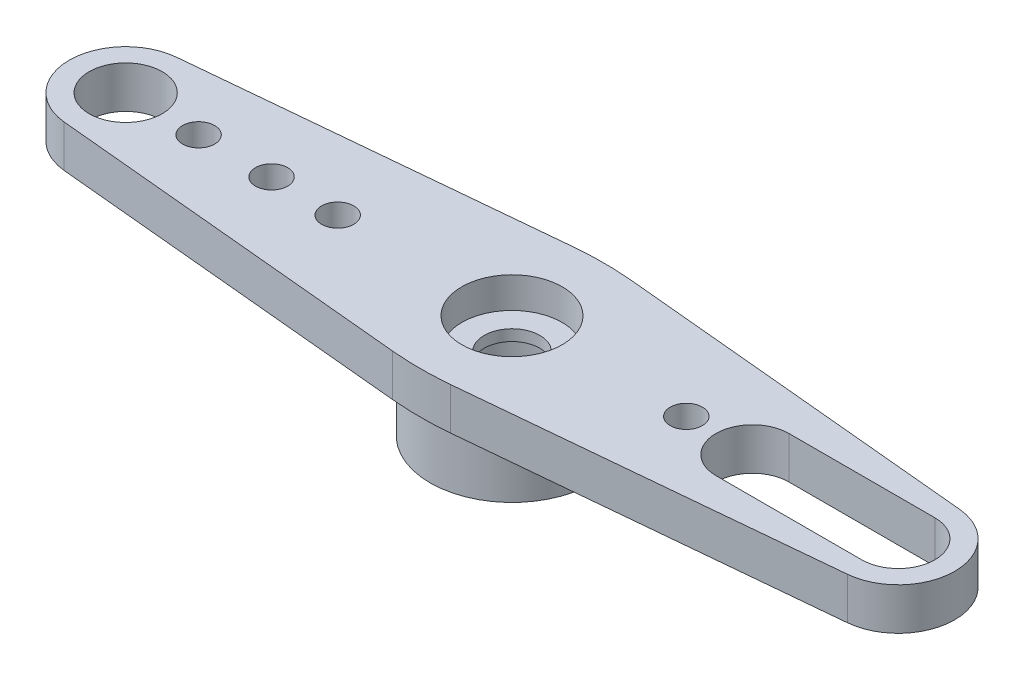
from build123d import *

# Parameters (mm, degrees)
SKETCH1_R           = 3.3655
SKETCH1_R_2         = 2.2352
BOSS_EXTRUDE1_DEPTH = 2.54
SKETCH2_R           = 0.6604
SKETCH2_R_2         = 1.5
SKETCH2_R_3         = 1.143
BOSS_EXTRUDE2_DEPTH = 1.7272
FILLET1_R           = 12.7
CUT_EXTRUDE1_START  = -1.27
SKETCH3_R           = 2.06375
SKETCH3_R_2         = 1.143
CUT_EXTRUDE1_DEPTH  = 1.27


with BuildPart() as part:
    # Sketch1 → Boss-Extrude1 (new body)
    with BuildSketch(Plane(origin=(0, 0, 0), x_dir=(1, 0, 0), z_dir=(0, 1, 0))):
        Circle(SKETCH1_R)
        Circle(SKETCH1_R_2, mode=Mode.SUBTRACT)
    extrude(amount=BOSS_EXTRUDE1_DEPTH)

    # Sketch2 → Boss-Extrude2 (add)
    with BuildSketch(Plane(origin=(0, 2.54, 0), x_dir=(1, 0, 0), z_dir=(0, 1, 0))):
        with BuildLine():
            Line((0, 3.8227), (-16.092265178, 2.307544345))
            ThreePointArc((-16.092265178, 2.307544345), (-18.19275, 0), (-16.092265178, -2.307544345))
            Line((-16.092265178, -2.307544345), (0, -3.8227))
            Line((0, -3.8227), (16.092265178, -2.307544345))
            ThreePointArc((16.092265178, -2.307544345), (18.19275, 0), (16.092265178, 2.307544345))
            Line((16.092265178, 2.307544345), (0, 3.8227))
        make_face()
        with BuildLine():
            Line((9.8806, 1.5), (15.875, 1.5))
            ThreePointArc((15.875, 1.5), (17.375, 0), (15.875, -1.5))
            Line((15.875, -1.5), (9.8806, -1.5))
            ThreePointArc((9.8806, -1.5), (8.3806, 0), (9.8806, 1.5))
        make_face(mode=Mode.SUBTRACT)
        with Locations((7.1628, 0)):
            Circle(SKETCH2_R, mode=Mode.SUBTRACT)
        with Locations((-7.1628, 0)):
            Circle(SKETCH2_R, mode=Mode.SUBTRACT)
        with Locations((-12.8778, 0)):
            Circle(SKETCH2_R, mode=Mode.SUBTRACT)
        with Locations((-9.8806, 0)):
            Circle(SKETCH2_R, mode=Mode.SUBTRACT)
        with Locations((-15.875, 0)):
            Circle(SKETCH2_R_2, mode=Mode.SUBTRACT)
        Circle(SKETCH2_R_3, mode=Mode.SUBTRACT)
    extrude(amount=BOSS_EXTRUDE2_DEPTH)

    # Fillet1
    fillet1_edges = [part.edges().sort_by_distance(p)[0] for p in [
        (0, 3.4036, -3.8227),
        (0, 3.4036, 3.8227),
    ]]
    fillet(fillet1_edges, radius=FILLET1_R)

    # Sketch3 → Cut-Extrude1 (cut)
    with BuildSketch(Plane(origin=(0, 4.2672, 0), x_dir=(1, 0, 0), z_dir=(0, 1, 0)).offset(CUT_EXTRUDE1_START)):
        Circle(SKETCH3_R)
        Circle(SKETCH3_R_2, mode=Mode.SUBTRACT)
    extrude(amount=CUT_EXTRUDE1_DEPTH, mode=Mode.SUBTRACT)


solid = part.part
